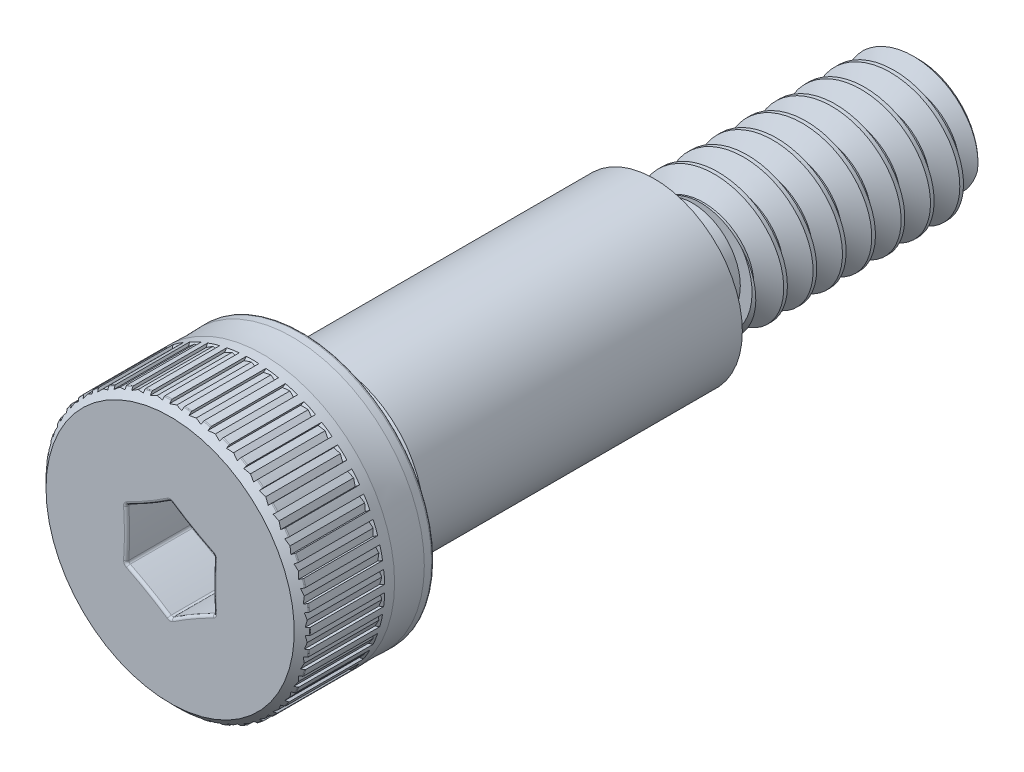
from build123d import *

# Parameters (mm, degrees)
SKETCH4_W             = 1.190625
SKETCH4_H             = 0.3175
SKETCH4_W_2           = 1.375833333
SKETCH4_H_2           = 0.687407664
CHAMFER1_SIZE         = 0.3175
FILLET1_R             = 0.1905
FILLET2_R             = 0.211666667
CHAMFER2_SIZE         = 0.264583333
CHAMFER3_SIZE         = 0.28575
CUT_EXTRUDE1_DEPTH    = 2.413
FILLET4_R             = 0.09525
DELETEFACE1_START     = -14.075833333
DELETEFACE1_OUTLINE_W = 6
DELETEFACE1_OUTLINE_H = 6
DELETEFACE1_OUTLINE_R = 1.725592336
DELETEFACE1_DEPTH     = 0.211666766
CUT_SWEEP1_PITCH      = 1.058333333
CUT_EXTRUDE2_REACH    = 29.815
CIRPATTERN1_COUNT     = 42
FILLET5_R             = 0.0508


# Read off the part's stored shape, not the designer's step: DeleteFace1, CirPattern2
with BuildPart() as part:
    # Sketch3 → Revolve1 (revolve)
    with BuildSketch(Plane(origin=(0, 0, 0), x_dir=(0, 0, -1), z_dir=(1, 0, 0)), mode=Mode.PRIVATE) as revolve1_sk:
        Polygon((-4.7625, 4.7625), (0, 4.7625), (0, 3.175), (12.7, 3.175), (12.7, 2.413), (22.225, 2.413), (22.225, 0), (-4.7625, 0), align=None)
    revolve(revolve1_sk.sketch.rotate(Axis((0, 0, 4.7625), (0, 0, -1)), 90), axis=Axis((0, 0, 4.7625), (0, 0, -1)))

    # Sketch4 → Cut-Revolve1 (revolve, cut)
    with BuildSketch(Plane(origin=(0, 0, 0), x_dir=(0, 0, -1), z_dir=(1, 0, 0)), mode=Mode.PRIVATE) as cut_revolve1_sk:
        with Locations((0.5953125, 3.01625)):
            Rectangle(SKETCH4_W, SKETCH4_H)
        with Locations((13.387916667, 2.069296168)):
            Rectangle(SKETCH4_W_2, SKETCH4_H_2)
    revolve(cut_revolve1_sk.sketch.rotate(Axis((0, 0, 4.7625), (0, 0, -1)), 90), axis=Axis((0, 0, 4.7625), (0, 0, -1)), mode=Mode.SUBTRACT)

    # Chamfer1
    chamfer1_edges = [part.edges().sort_by_distance(p)[0] for p in [
        (-2.8575, 0, -1.190625),
    ]]
    chamfer(chamfer1_edges, length=CHAMFER1_SIZE - 0.0001)  # a hair under: the kernel refuses the full size

    # Fillet1
    fillet1_edges = [part.edges().sort_by_distance(p)[0] for p in [
        (-2.8575, 0, 0),
    ]]
    fillet(fillet1_edges, radius=FILLET1_R)

    # Fillet2
    fillet2_edges = [part.edges().sort_by_distance(p)[0] for p in [
        (-1.725592336, 0, -12.7),
        (-1.725592336, 0, -14.075833333),
    ]]
    fillet(fillet2_edges, radius=FILLET2_R)

    # Chamfer2
    chamfer2_edges = [part.edges().sort_by_distance(p)[0] for p in [
        (-2.413, 0, -14.075833333),
        (-2.413, 0, -22.225),
    ]]
    chamfer(chamfer2_edges, length=CHAMFER2_SIZE)

    # Chamfer3
    chamfer3_edges = [part.edges().sort_by_distance(p)[0] for p in [
        (-4.7625, 0, 4.7625),
    ]]
    chamfer(chamfer3_edges, length=CHAMFER3_SIZE)

    # Sketch5 → Cut-Extrude1 (cut)
    with BuildSketch(Plane.XY.offset(4.7625)):
        with BuildLine():
            ThreePointArc((1.5875, 0.916543552), (0.777875, 1.347319022), (0, 1.833087105))
            ThreePointArc((0, 1.833087105), (-0.777875, 1.347319022), (-1.5875, 0.916543552))
            ThreePointArc((-1.5875, 0.916543552), (-1.55575, 0), (-1.5875, -0.916543552))
            ThreePointArc((-1.5875, -0.916543552), (-0.777875, -1.347319022), (0, -1.833087105))
            ThreePointArc((0, -1.833087105), (0.777875, -1.347319022), (1.5875, -0.916543552))
            ThreePointArc((1.5875, -0.916543552), (1.55575, 0), (1.5875, 0.916543552))
        make_face()
    extrude(amount=-CUT_EXTRUDE1_DEPTH, mode=Mode.SUBTRACT)

    # Fillet4
    fillet4_edges = [part.edges().sort_by_distance(p)[0] for p in [
        (1.55575, 0, 2.3495),
        (1.5875, 0.916543552, 3.556),
        (0.777875, -1.347319022, 2.3495),
        (1.5875, -0.916543552, 3.556),
        (-0.777875, -1.347319022, 2.3495),
        (0, -1.833087105, 3.556),
        (-1.55575, 0, 2.3495),
        (-1.5875, -0.916543552, 3.556),
        (-0.777875, 1.347319022, 2.3495),
        (-1.5875, 0.916543552, 3.556),
        (0.777875, 1.347319022, 2.3495),
        (0, 1.833087105, 3.556),
        (1.55575, 0, 4.7625),
        (0.777875, 1.347319022, 4.7625),
        (-0.777875, 1.347319022, 4.7625),
        (-1.55575, 0, 4.7625),
        (-0.777875, -1.347319022, 4.7625),
        (0.777875, -1.347319022, 4.7625),
        (-4.7625, 0, 0),
    ]]
    fillet(fillet4_edges, radius=FILLET4_R)

    # DeleteFace1 outline → DeleteFace1 (cut)
    with BuildSketch(Plane.XY.offset(DELETEFACE1_START)):
        Rectangle(DELETEFACE1_OUTLINE_W, DELETEFACE1_OUTLINE_H)
        Circle(DELETEFACE1_OUTLINE_R, mode=Mode.SUBTRACT)
    extrude(amount=DELETEFACE1_DEPTH, mode=Mode.SUBTRACT)

    # Cut-Sweep1: the profile of Sketch7 profile screwed along a right-hand helix of 8.48 turns, 8 arcs to a turn; built about Z, then put on its axis
    cut_sweep1_z = Axis((0, 0, 0), (0, 0, 1))
    cut_sweep1_corners = [(2.470283972, 0, 0.033072917), (2.470283972, 0, -0.959114583), (1.725292336, 0, -0.528993462), (1.725292336, 0, -0.397048205)]
    with BuildLine(mode=Mode.PRIVATE) as cut_sweep1_profile:
        Line(cut_sweep1_corners[0], cut_sweep1_corners[1])
        Line(cut_sweep1_corners[1], cut_sweep1_corners[2])
        Line(cut_sweep1_corners[2], cut_sweep1_corners[3])
        Line(cut_sweep1_corners[3], cut_sweep1_corners[0])
    cut_sweep1_cap = Face(cut_sweep1_profile.wire())
    cut_sweep1_turn_angles = [0, 22.5, 45, 67.5, 90, 112.5, 135, 157.5, 180, 202.5, 225, 247.5, 270, 292.5, 315, 337.5, 360]
    cut_sweep1_turn_weights = [1, 0.9238795325112867, 1, 0.9238795325112867, 1, 0.9238795325112867, 1, 0.9238795325112867, 1, 0.9238795325112867, 1, 0.9238795325112867, 1, 0.9238795325112867, 1, 0.9238795325112867, 1]
    cut_sweep1_turn_rails = [Edge.make_bspline([Vector(p[0], p[1], 0).rotate(cut_sweep1_z, cut_sweep1_turn_angles[k]) / cut_sweep1_turn_weights[k] + Vector(0, 0, p[2] + CUT_SWEEP1_PITCH * cut_sweep1_turn_angles[k] / 360) for k in range(17)], [0, 0, 0, 1, 1, 2, 2, 3, 3, 4, 4, 5, 5, 6, 6, 7, 7, 8, 8, 8], 2, cut_sweep1_turn_weights) for p in cut_sweep1_corners]
    cut_sweep1_turn_sides = [Face.make_surface_from_curves(cut_sweep1_turn_rails[p[0]], cut_sweep1_turn_rails[p[1]]) for p in [(0, 1), (1, 2), (2, 3), (3, 0)]]
    cut_sweep1_last_angles = [2880, 2902.5, 2925, 2947.5, 2970, 2992.5, 3015, 3033.9, 3052.8]
    cut_sweep1_last_weights = [1, 0.9238795325112867, 1, 0.9238795325112867, 1, 0.9238795325112867, 1, 0.946085358827591, 1]
    cut_sweep1_last_rails = [Edge.make_bspline([Vector(p[0], p[1], 0).rotate(cut_sweep1_z, cut_sweep1_last_angles[k]) / cut_sweep1_last_weights[k] + Vector(0, 0, p[2] + CUT_SWEEP1_PITCH * cut_sweep1_last_angles[k] / 360) for k in range(9)], [0, 0, 0, 1, 1, 2, 2, 3, 3, 4, 4, 4], 2, cut_sweep1_last_weights) for p in cut_sweep1_corners]
    cut_sweep1_last_sides = [Face.make_surface_from_curves(cut_sweep1_last_rails[p[0]], cut_sweep1_last_rails[p[1]]) for p in [(0, 1), (1, 2), (2, 3), (3, 0)]]
    cut_sweep1 = Plane(origin=(0, 0, -22.225), x_dir=(0, 1, 0), z_dir=(0, 0, 1)) * Solid(Shell([*[p.moved(Location((0, 0, CUT_SWEEP1_PITCH * i))) for i in range(8) for p in cut_sweep1_turn_sides], *cut_sweep1_last_sides, cut_sweep1_cap, cut_sweep1_cap.rotate(cut_sweep1_z, 3052.8).moved(Location((0, 0, CUT_SWEEP1_PITCH * 3052.8 / 360)))]))
    add(cut_sweep1, mode=Mode.SUBTRACT)

    # Cut-Extrude2: up to this plane
    cut_extrude2_end = Plane(origin=(0, 5.814873764, 0.733563736), z_dir=(0, 0.707106781186546, 0.7071067811865491))
    # Sketch8 → Cut-Extrude2 (cut, up to the surface)
    with BuildSketch(Plane.XY.offset(4.7625), mode=Mode.PRIVATE) as cut_extrude2_sk1:
        Polygon((-0.2286, 4.7625), (0.2286, 4.7625), (0.218989269, 4.67106), (0, 4.71678), (-0.218989269, 4.67106), align=None)
    cut_extrude2_tool1 = split(extrude(cut_extrude2_sk1.sketch, amount=-CUT_EXTRUDE2_REACH, mode=Mode.PRIVATE), bisect_by=cut_extrude2_end, keep=Keep.BOTH, mode=Mode.PRIVATE)
    cut_extrude2 = cut_extrude2_tool1.solids().sort_by_distance((0, 4.727084, 4.7625))[0]
    add(cut_extrude2, mode=Mode.SUBTRACT)

    # CirPattern1: Cut-Extrude2 ×42 about axis
    cirpattern1_axis = Axis((0, 0, 0), (0, 0, 1))
    for i in range(1, CIRPATTERN1_COUNT):
        add(cut_extrude2.rotate(cirpattern1_axis, i * 360 / CIRPATTERN1_COUNT), mode=Mode.SUBTRACT)

    # Fillet5
    fillet5_edges = [part.edges().sort_by_distance(p)[0] for p in [
        (0.355902071, 4.749183084, 4.47675),
    ]]
    fillet(fillet5_edges, radius=FILLET5_R)

    # CirPattern2 outline → CirPattern2 (revolve, cut)
    with BuildSketch(Plane.XZ):
        with BuildLine():
            ThreePointArc((4.747621024, 4.491628976), (4.75863308, 4.47514827), (4.7625, 4.455707951))
            Line((4.7625, 4.455707951), (4.7625, 4.491628976))
            Line((4.7625, 4.491628976), (4.747621024, 4.491628976))
        make_face()
    revolve(axis=Axis((0, 0, 0), (0, 0, 1)), mode=Mode.SUBTRACT)

    # Sketch11 → Cut-Revolve6 (revolve, cut)
    with BuildSketch(Plane(origin=(0, 0, 0), x_dir=(0, 0, -1), z_dir=(1, 0, 0)), mode=Mode.PRIVATE) as cut_revolve6_sk:
        with BuildLine():
            Line((-1.42875, 4.7625), (-0.3571875, 4.7625))
            ThreePointArc((-0.3571875, 4.7625), (-0.89296875, 4.74472), (-1.42875, 4.7625))
        make_face()
    revolve(cut_revolve6_sk.sketch.rotate(Axis((0, 0, 4.7625), (0, 0, -1)), 90), axis=Axis((0, 0, 4.7625), (0, 0, -1)), mode=Mode.SUBTRACT)


solid = part.part
